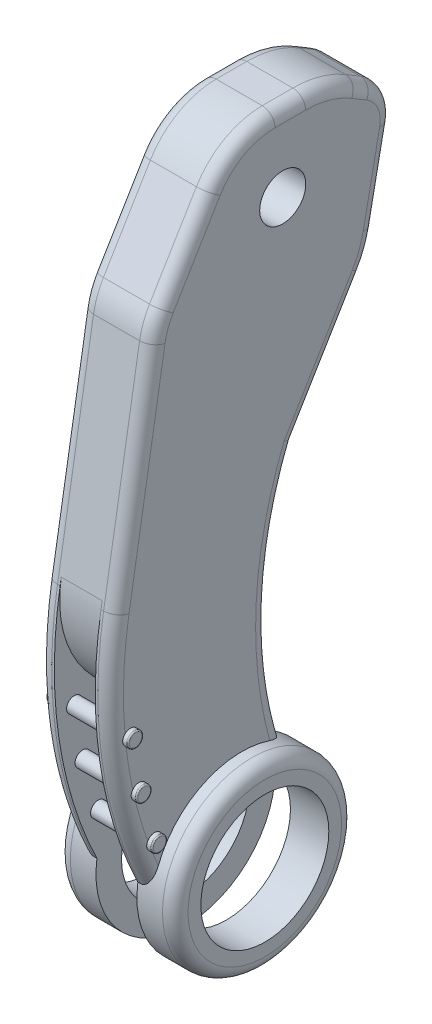
from build123d import *

# Parameters (mm, degrees)
SKETCH1_R                = 11.43
BOSS_EXTRUDE1_DEPTH      = 17.78
FILLET1_R                = 38.1
FILLET2_R                = 50.8
FILLET3_R                = 20.32
CUT_EXTRUDE1_REACH       = 308.4
FILLET4_R                = 6.35
SKETCH3_R                = 37.473973474
BOSS_EXTRUDE2_DEPTH      = 19.05
SKETCH4_R                = 44.45
BOSS_EXTRUDE3_DEPTH      = 10.16
FILLET5_R                = 6.35
SKETCH5_R                = 31.75
CUT_EXTRUDE2_DEPTH       = 334.443580493
CUT_EXTRUDE3_DEPTH       = 10.16
SKETCH7_W                = 127
SKETCH7_H                = 152.4
CUT_EXTRUDE4_DEPTH       = 10.16
FILLET7_R                = 58.42
BOSS_EXTRUDE4_DEPTH      = 30.48
BOSS_EXTRUDE4_DEPTH_BACK = 10.16
SKETCH8_R                = 3.81
FILLET8_R                = 0.635
FILLET9_R                = 15.24


with BuildPart() as part:
    # Sketch1 → Boss-Extrude1 (new, symmetric)
    with BuildSketch(Plane(origin=(0, 0, 0), x_dir=(0, 0, -1), z_dir=(1, 0, 0))):
        with BuildLine():
            Line((-25.4, 38.1), (25.4, 38.1))
            Line((25.4, 38.1), (57.15, 19.05))
            Line((57.15, 19.05), (44.45, -44.45))
            Line((44.45, -44.45), (6.35, -107.95))
            ThreePointArc((6.35, -107.95), (-0.548229856, -158.75), (6.35, -209.55))
            Line((6.35, -209.55), (25.4, -222.25))
            Line((25.4, -222.25), (-38.1, -292.1))
            Line((-38.1, -292.1), (-57.15, -279.4))
            ThreePointArc((-57.15, -279.4), (-82.020155442, -211.762755535), (-82.55, -139.7))
            Line((-82.55, -139.7), (-63.5, -25.4))
            Line((-63.5, -25.4), (-25.4, 38.1))
        make_face()
        with Locations(Location((0, 0, 0), (0, 0, 180))):
            Circle(SKETCH1_R, mode=Mode.SUBTRACT)
    extrude(amount=BOSS_EXTRUDE1_DEPTH, both=True)

    # Fillet1
    fillet1_edges = [part.edges().sort_by_distance(p)[0] for p in [
        (0, 38.1, 25.4),
        (0, -25.4, 63.5),
    ]]
    fillet(fillet1_edges, radius=FILLET1_R)

    # Fillet2
    fillet2_edges = [part.edges().sort_by_distance(p)[0] for p in [
        (0, 38.1, -25.4),
        (0, -44.45, -44.45),
    ]]
    fillet(fillet2_edges, radius=FILLET2_R)

    # Fillet3
    fillet3_edges = [part.edges().sort_by_distance(p)[0] for p in [
        (0, 19.05, -57.15),
    ]]
    fillet(fillet3_edges, radius=FILLET3_R)

    # Sketch2 → Cut-Extrude1 (cut, up to next)
    with BuildSketch(Plane(origin=(17.78, 0, 0), x_dir=(0, 0, -1), z_dir=(1, 0, 0)), mode=Mode.PRIVATE) as cut_extrude1_sk1:
        with BuildLine():
            Line((6.35, -107.95), (25.4, -222.25))
            Line((25.4, -222.25), (4.896933239, -244.803373437))
            ThreePointArc((4.896933239, -244.803373437), (-7.090804158, -176.241690527), (6.35, -107.95))
        make_face()
    cut_extrude1_tool1 = extrude(cut_extrude1_sk1.sketch, amount=-CUT_EXTRUDE1_REACH, mode=Mode.PRIVATE) & part.part
    add(cut_extrude1_tool1.solids().sort_by_distance((17.78, -184.651324, -6.869264))[0], mode=Mode.SUBTRACT)

    # Fillet4
    fillet4_edges = [part.edges().sort_by_distance(p)[0] for p in [
        (17.78, -211.762755535, 82.020155442),
        (-17.78, -79.972650946, -23.136409432),
        (-17.78, -211.762755535, 82.020155442),
        (17.78, -79.972650946, -23.136409432),
        (-17.78, 0.202698238, 48.138381057),
        (17.78, 0.202698238, 48.138381057),
        (-17.78, -86.117789336, 73.619631556),
        (-17.78, -25.635181565, 62.861243845),
        (-17.78, 33.154616447, 22.599971412),
        (17.78, -86.117789336, 73.619631556),
        (17.78, -25.635181565, 62.861243845),
        (17.78, 33.154616447, 22.599971412),
        (-17.78, -15.406714291, -50.258657142),
        (17.78, -15.406714291, -50.258657142),
        (-17.78, 38.1, -3.75053401),
        (-17.78, 36.256718353, -24.889440541),
        (-17.78, -44.177228696, -43.744447871),
        (17.78, 38.1, -3.75053401),
        (17.78, 36.256718353, -24.889440541),
        (17.78, -44.177228696, -43.744447871),
        (-17.78, 28.639082671, -41.168195548),
        (17.78, 28.639082671, -41.168195548),
        (-17.78, 17.213797309, -52.999168878),
        (17.78, 17.213797309, -52.999168878),
        (17.78, -176.241690527, 7.090804158),
        (-17.78, -176.241690527, 7.090804158),
    ]]
    fillet(fillet4_edges, radius=FILLET4_R)

    # Sketch3 → Boss-Extrude2 (add, symmetric)
    with BuildSketch(Plane(origin=(0, 0, 0), x_dir=(0, 0, -1), z_dir=(1, 0, 0))):
        with Locations((-20.3107892, -272.53186812)):
            Circle(SKETCH3_R)
    extrude(amount=BOSS_EXTRUDE2_DEPTH, both=True)

    # Sketch4 → Boss-Extrude3 (add, symmetric)
    with BuildSketch(Plane(origin=(19.05, 0, 0), x_dir=(0, 0, -1), z_dir=(1, 0, 0))):
        with Locations(Location((-20.3107892, -272.53186812, 0), (0, 0, 171.543274071))):
            Circle(SKETCH4_R)
    boss_extrude3 = extrude(amount=BOSS_EXTRUDE3_DEPTH, both=True)

    # Mirror1: Boss-Extrude3 across plane
    add(boss_extrude3.mirror(Plane(origin=(0, 0, 0), x_dir=(0, 0, 1), z_dir=(1, 0, 0))))

    # Fillet5
    fillet5_edges = [part.edges().sort_by_distance(p)[0] for p in [
        (29.21, -279.068791358, -23.655915641),
        (-29.21, -279.068791358, -23.655915641),
    ]]
    fillet(fillet5_edges, radius=FILLET5_R)

    # Sketch5 → Cut-Extrude2 (cut, through all)
    with BuildSketch(Plane(origin=(29.21, 0, 0), x_dir=(0, 0, -1), z_dir=(1, 0, 0))):
        with Locations((-20.3107892, -272.53186812)):
            Circle(SKETCH5_R)
    extrude(amount=-CUT_EXTRUDE2_DEPTH, mode=Mode.SUBTRACT)

    # Sketch6 → Cut-Extrude3 (cut, symmetric)
    with BuildSketch(Plane(origin=(0, 0, 0), x_dir=(0, 0, -1), z_dir=(1, 0, 0))):
        Polygon((-51.380567676, -265.994944881), (-6.935865697, -170.321013364), (42.365014062, -321.25384575), (-147.894580379, -308.584592191), align=None)
    extrude(amount=CUT_EXTRUDE3_DEPTH, both=True, mode=Mode.SUBTRACT)

    # Sketch7 → Cut-Extrude4 (cut, symmetric)
    with BuildSketch(Plane(origin=(0, 0, 0), x_dir=(0, 0, -1), z_dir=(1, 0, 0))):
        with Locations((-19.743003213, -280.46958116)):
            Rectangle(SKETCH7_W, SKETCH7_H)
    extrude(amount=CUT_EXTRUDE4_DEPTH, both=True, mode=Mode.SUBTRACT)

    # Fillet7
    # the kernel refuses this fillet: 58.42 mm, written as the material it takes off along each edge
    with BuildSketch(Plane(origin=(-10.16, -204.26958116, 83.243003213), x_dir=(0, 0, -1), z_dir=(1, 0, 0))) as fillet7_piece_1:
        with BuildLine():
            CenterArc((58.89390419, 58.42), FILLET7_R, 170.537677792, 99.462322208)
            Line((1.268771159, 68.024188838), (-4.493742144, 68.984607722))
            ThreePointArc((-4.493742144, 68.984607722), (-5.06951009, 65.530000044), (-5.781799209, -0.836517729))
            Line((-5.781799209, -0.836517729), (0, -5.842))
            Line((0, -5.842), (58.89390419, -5.842))
            Line((58.89390419, -5.842), (58.89390419, 0))
        make_face()
    extrude(amount=20.32, mode=Mode.SUBTRACT)

    # Sketch8 → Boss-Extrude4 (add, two sides: drawn at the far end of the back side and taken through both)
    with BuildSketch(Plane(origin=(-10.16, 0, 0), x_dir=(0, 0, -1), z_dir=(1, 0, 0)).offset(-BOSS_EXTRUDE4_DEPTH_BACK)):
        with Locations(Location((-63.627324715, -245.034717228, 0), (0, 0, 180))):
            Circle(SKETCH8_R)
        with Locations(Location((-71.31712828, -219.634717228, 0), (0, 0, 180))):
            Circle(SKETCH8_R)
        with Locations(Location((-75.516477779, -194.234717228, 0), (0, 0, 180))):
            Circle(SKETCH8_R)
    extrude(amount=BOSS_EXTRUDE4_DEPTH + BOSS_EXTRUDE4_DEPTH_BACK)

    # Fillet8
    fillet8_edges = [part.edges().sort_by_distance(p)[0] for p in [
        (-20.32, -245.034717228, 59.817324715),
        (20.32, -245.034717228, 59.817324715),
        (-20.32, -219.634717228, 67.50712828),
        (20.32, -219.634717228, 67.50712828),
        (-20.32, -194.234717228, 71.706477779),
        (20.32, -194.234717228, 71.706477779),
    ]]
    fillet(fillet8_edges, radius=FILLET8_R)

    # Fillet9
    fillet9_edges = [part.edges().sort_by_distance(p)[0] for p in [
        (0, -204.26958116, 22.706451837),
    ]]
    fillet(fillet9_edges, radius=FILLET9_R)


solid = part.part
